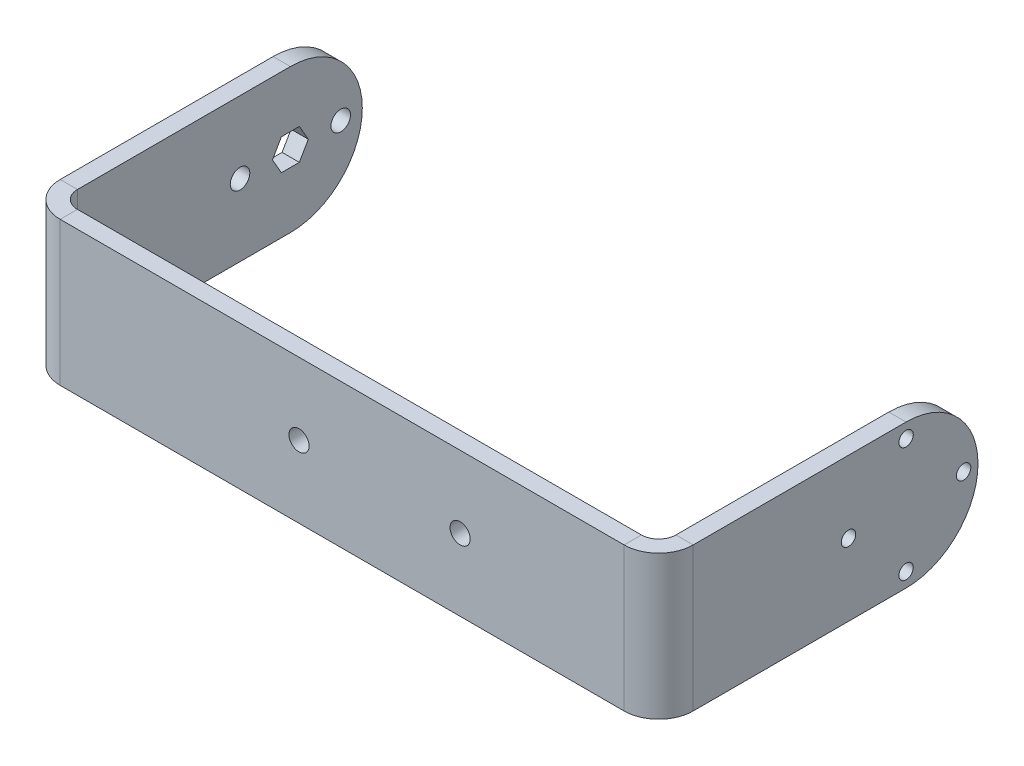
from build123d import *

# Parameters (mm, degrees)
T_LE_START                            = -1.5
T_LE_DE_BASE_PLI_E2_OUTLINE_W         = 104
T_LE_DE_BASE_PLI_E2_OUTLINE_H         = 25
T_LE_DE_BASE_PLI_E2_DEPTH             = 3
T_LE_PLI_E_SUR_AR_TE1_STRIP_W         = 18
T_LE_PLI_E_SUR_AR_TE1_STRIP_H         = 3
T_LE_PLI_E_SUR_AR_TE1_STRIP_CUT_DEPTH = 25
T_LE_PLI_E_SUR_AR_TE1_DEPTH           = 25
T_LE_PLI_E_SUR_AR_TE2_STRIP_W         = 18
T_LE_PLI_E_SUR_AR_TE2_STRIP_H         = 3
T_LE_PLI_E_SUR_AR_TE2_STRIP_CUT_DEPTH = 25
T_LE_PLI_E_SUR_AR_TE2_DEPTH           = 25
ENL_V_MAT_EXTRU_1_REACH               = 72.924
ESQUISSE20_R                          = 1.75
PATTE1_DEPTH                          = 3
PATTE2_START                          = -3
PATTE2_DEPTH                          = 3
ENL_V_MAT_EXTRU_2_REACH               = 125.176
ESQUISSE27_R                          = 1.25
ENL_V_MAT_EXTRU_3_REACH               = 122.504
ENL_V_MAT_EXTRU_4_REACH               = 125.176
ESQUISSE29_R                          = 1.7


# Read off the part's stored shape, not the designer's step: Tôle de base pliée2
# Sheet-metal steps are written as plain solids
with BuildPart() as part:
    # Tôle de base pliée2 outline → Tôle de base pliée2 (new body)
    with BuildSketch(Plane.XY.offset(T_LE_START)):
        Rectangle(T_LE_DE_BASE_PLI_E2_OUTLINE_W, T_LE_DE_BASE_PLI_E2_OUTLINE_H)
    extrude(amount=T_LE_DE_BASE_PLI_E2_DEPTH)

    # Tôle pliée sur arête1 strip (across the edge) → Tôle pliée sur arête1 strip cut (cut)
    with BuildSketch(Plane(origin=(52, 12.5, -1.5), x_dir=(-1, 0, 0), z_dir=(0, -1, 0))):
        with Locations((-6, -1.5)):
            Rectangle(T_LE_PLI_E_SUR_AR_TE1_STRIP_W, T_LE_PLI_E_SUR_AR_TE1_STRIP_H)
    extrude(amount=T_LE_PLI_E_SUR_AR_TE1_STRIP_CUT_DEPTH, mode=Mode.SUBTRACT)

    # Tôle pliée sur arête1 section (across the edge) → Tôle pliée sur arête1 (add)
    with BuildSketch(Plane(origin=(52, 12.5, -1.5), x_dir=(-1, 0, 0), z_dir=(0, -1, 0))):
        with BuildLine():
            Line((-3, 3), (-3, 40))
            Line((-3, 40), (0, 40))
            Line((0, 40), (0, 3))
            ThreePointArc((0, 3), (0.878679656, 0.878679656), (3, 0))
            Line((3, 0), (3, -3))
            ThreePointArc((3, -3), (-1.242640687, -1.242640687), (-3, 3))
        make_face()
    extrude(amount=T_LE_PLI_E_SUR_AR_TE1_DEPTH)

    # Tôle pliée sur arête2 strip (across the edge) → Tôle pliée sur arête2 strip cut (cut)
    with BuildSketch(Plane(origin=(-52, -12.5, -1.5), x_dir=(1, 0, 0), z_dir=(0, 1, 0))):
        with Locations((-6, -1.5)):
            Rectangle(T_LE_PLI_E_SUR_AR_TE2_STRIP_W, T_LE_PLI_E_SUR_AR_TE2_STRIP_H)
    extrude(amount=T_LE_PLI_E_SUR_AR_TE2_STRIP_CUT_DEPTH, mode=Mode.SUBTRACT)

    # Tôle pliée sur arête2 section (across the edge) → Tôle pliée sur arête2 (add)
    with BuildSketch(Plane(origin=(-52, -12.5, -1.5), x_dir=(1, 0, 0), z_dir=(0, 1, 0))):
        with BuildLine():
            Line((-3, 3), (-3, 40))
            Line((-3, 40), (0, 40))
            Line((0, 40), (0, 3))
            ThreePointArc((0, 3), (0.878679656, 0.878679656), (3, 0))
            Line((3, 0), (3, -3))
            ThreePointArc((3, -3), (-1.242640687, -1.242640687), (-3, 3))
        make_face()
    extrude(amount=T_LE_PLI_E_SUR_AR_TE2_DEPTH)

    # Esquisse20 → Enlèv. mat.-Extru.1 (cut, up to next)
    with BuildSketch(Plane.XY.offset(1.5), mode=Mode.PRIVATE) as enl_v_mat_extru_1_sk1:
        with Locations((-7.5, 0)):
            Circle(ESQUISSE20_R)
    enl_v_mat_extru_1_tool1 = extrude(enl_v_mat_extru_1_sk1.sketch, amount=-ENL_V_MAT_EXTRU_1_REACH, mode=Mode.PRIVATE) & part.part
    # Esquisse20 → Enlèv. mat.-Extru.1 (cut, up to next)
    with BuildSketch(Plane.XY.offset(1.5), mode=Mode.PRIVATE) as enl_v_mat_extru_1_sk2:
        with Locations((20.5, 0)):
            Circle(ESQUISSE20_R)
    enl_v_mat_extru_1_tool2 = extrude(enl_v_mat_extru_1_sk2.sketch, amount=-ENL_V_MAT_EXTRU_1_REACH, mode=Mode.PRIVATE) & part.part
    add(enl_v_mat_extru_1_tool1.solids().sort_by_distance((-7.5, 0, 1.5))[0], mode=Mode.SUBTRACT)
    add(enl_v_mat_extru_1_tool2.solids().sort_by_distance((20.5, 0, 1.5))[0], mode=Mode.SUBTRACT)

    # Esquisse21 → Patte1 (add)
    with BuildSketch(Plane.ZY.offset(55)):
        with BuildLine():
            Line((-41.5, 12.5), (-41.5, -12.5))
            ThreePointArc((-41.5, -12.5), (-54, 0), (-41.5, 12.5))
        make_face()
    extrude(amount=-PATTE1_DEPTH)

    # Esquisse24 → Patte2 (add)
    with BuildSketch(Plane(origin=(55, 0, 0), x_dir=(0, 0, -1), z_dir=(1, 0, 0)).offset(PATTE2_START)):
        with BuildLine():
            Line((41.5, 12.5), (41.5, -12.5))
            ThreePointArc((41.5, -12.5), (54, 0), (41.5, 12.5))
        make_face()
    extrude(amount=PATTE2_DEPTH)

    # Esquisse27 → Enlèv. mat.-Extru.2 (cut, up to next)
    with BuildSketch(Plane(origin=(55, 0, 0), x_dir=(0, 0, -1), z_dir=(1, 0, 0)), mode=Mode.PRIVATE) as enl_v_mat_extru_2_sk1:
        with Locations((51.5, 0)):
            Circle(ESQUISSE27_R)
    enl_v_mat_extru_2_tool1 = extrude(enl_v_mat_extru_2_sk1.sketch, amount=-ENL_V_MAT_EXTRU_2_REACH, mode=Mode.PRIVATE) & part.part
    # Esquisse27 → Enlèv. mat.-Extru.2 (cut, up to next)
    with BuildSketch(Plane(origin=(55, 0, 0), x_dir=(0, 0, -1), z_dir=(1, 0, 0)), mode=Mode.PRIVATE) as enl_v_mat_extru_2_sk2:
        with Locations((41.5, -10)):
            Circle(ESQUISSE27_R)
    enl_v_mat_extru_2_tool2 = extrude(enl_v_mat_extru_2_sk2.sketch, amount=-ENL_V_MAT_EXTRU_2_REACH, mode=Mode.PRIVATE) & part.part
    # Esquisse27 → Enlèv. mat.-Extru.2 (cut, up to next)
    with BuildSketch(Plane(origin=(55, 0, 0), x_dir=(0, 0, -1), z_dir=(1, 0, 0)), mode=Mode.PRIVATE) as enl_v_mat_extru_2_sk3:
        with Locations((31.5, 0)):
            Circle(ESQUISSE27_R)
    enl_v_mat_extru_2_tool3 = extrude(enl_v_mat_extru_2_sk3.sketch, amount=-ENL_V_MAT_EXTRU_2_REACH, mode=Mode.PRIVATE) & part.part
    # Esquisse27 → Enlèv. mat.-Extru.2 (cut, up to next)
    with BuildSketch(Plane(origin=(55, 0, 0), x_dir=(0, 0, -1), z_dir=(1, 0, 0)), mode=Mode.PRIVATE) as enl_v_mat_extru_2_sk4:
        with Locations((41.5, 10)):
            Circle(ESQUISSE27_R)
    enl_v_mat_extru_2_tool4 = extrude(enl_v_mat_extru_2_sk4.sketch, amount=-ENL_V_MAT_EXTRU_2_REACH, mode=Mode.PRIVATE) & part.part
    add(enl_v_mat_extru_2_tool1.solids().sort_by_distance((55, 0, -51.5))[0], mode=Mode.SUBTRACT)
    add(enl_v_mat_extru_2_tool2.solids().sort_by_distance((55, -10, -41.5))[0], mode=Mode.SUBTRACT)
    add(enl_v_mat_extru_2_tool3.solids().sort_by_distance((55, 0, -31.5))[0], mode=Mode.SUBTRACT)
    add(enl_v_mat_extru_2_tool4.solids().sort_by_distance((55, 10, -41.5))[0], mode=Mode.SUBTRACT)

    # Esquisse28 → Enlèv. mat.-Extru.3 (cut, up to next)
    with BuildSketch(Plane(origin=(-52, 0, 0), x_dir=(0, 0, -1), z_dir=(1, 0, 0)), mode=Mode.PRIVATE) as enl_v_mat_extru_3_sk1:
        Polygon((43.058845727, -2.7), (44.617691454, 0), (43.058845727, 2.7), (39.941154273, 2.7), (38.382308546, 0), (39.941154273, -2.7), align=None)
    enl_v_mat_extru_3_tool1 = extrude(enl_v_mat_extru_3_sk1.sketch, amount=-ENL_V_MAT_EXTRU_3_REACH, mode=Mode.PRIVATE) & part.part
    add(enl_v_mat_extru_3_tool1.solids().sort_by_distance((-52, 0, -41.5))[0], mode=Mode.SUBTRACT)

    # Esquisse29 → Enlèv. mat.-Extru.4 (cut, up to next)
    with BuildSketch(Plane.ZY.offset(55), mode=Mode.PRIVATE) as enl_v_mat_extru_4_sk1:
        with Locations((-50.25, 0)):
            Circle(ESQUISSE29_R)
    enl_v_mat_extru_4_tool1 = extrude(enl_v_mat_extru_4_sk1.sketch, amount=-ENL_V_MAT_EXTRU_4_REACH, mode=Mode.PRIVATE) & part.part
    # Esquisse29 → Enlèv. mat.-Extru.4 (cut, up to next)
    with BuildSketch(Plane.ZY.offset(55), mode=Mode.PRIVATE) as enl_v_mat_extru_4_sk2:
        with Locations((-32.75, 0)):
            Circle(ESQUISSE29_R)
    enl_v_mat_extru_4_tool2 = extrude(enl_v_mat_extru_4_sk2.sketch, amount=-ENL_V_MAT_EXTRU_4_REACH, mode=Mode.PRIVATE) & part.part
    add(enl_v_mat_extru_4_tool1.solids().sort_by_distance((-55, 0, -50.25))[0], mode=Mode.SUBTRACT)
    add(enl_v_mat_extru_4_tool2.solids().sort_by_distance((-55, 0, -32.75))[0], mode=Mode.SUBTRACT)


solid = part.part
